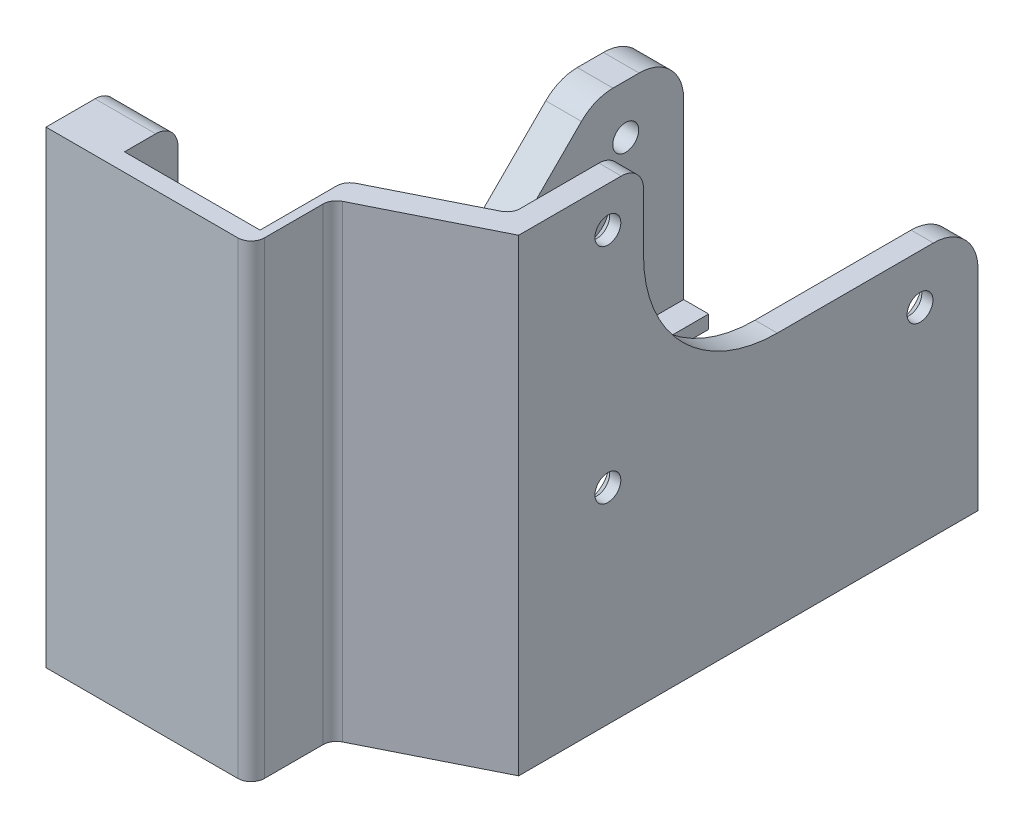
from build123d import *

# Parameters (mm, degrees)
EXTRUDE_1_DEPTH          = 105
SKETCH_7_W               = 30.4
SKETCH_7_H               = 19
EXTRUDE_2_DEPTH          = 3
SKETCH_8_W               = 30.4
SKETCH_8_H               = 12
EXTRUDE_3_DEPTH          = 38
FILLET_1_R               = 5
CUT_EXTRUDE_1_DEPTH      = 112
CUT_EXTRUDE_2_DEPTH      = 97
CUT_EXTRUDE_4_DEPTH      = 187.349134691
CUT_EXTRUDE_4_DEPTH_BACK = 6.8
SKETCH_11_R              = 5
FILLET_3_R               = 3
SKETCH_12_R              = 2.6
CUT_EXTRUDE_5_DEPTH      = 20
CHAMFER_1_SIZE           = 3
SKETCH_13_R              = 2.9
CUT_EXTRUDE_6_DEPTH      = 187.349134691
CHAMFER_3_SIZE           = 2.5
SKETCH_16_W              = 75
SKETCH_16_H              = 48
CUT_EXTRUDE_9_DEPTH      = 187.349134691
FILLET_4_R               = 30
SKETCH_17_W              = 28
SKETCH_17_H              = 52
CUT_EXTRUDE_10_DEPTH     = 20
FILLET_5_R               = 8
SKETCH_18_W              = 8
SKETCH_18_H              = 19
EXTRUDE_4_DEPTH          = 49
CHAMFER_4_SIZE           = 50
FILLET_6_R               = 10
SKETCH_19_R              = 2.9
CUT_EXTRUDE_11_DEPTH     = 187.349134691
CHAMFER_5_SIZE           = 2.6
SKETCH_21_R              = 2.3
CUT_EXTRUDE_13_DEPTH     = 15
FILLET_7_R               = 5
CHAMFER_6_SIZE           = 0.8
SKETCH_22_W              = 8
SKETCH_22_H              = 43.683816014
EXTRUDE_5_DEPTH          = 10
FILLET_8_R               = 10


with BuildPart() as part:
    # Эскиз2 → Бобышка-Вытянуть1 (new body)
    with BuildSketch(Plane(origin=(0, 0, 0), x_dir=(1, 0, 0), z_dir=(0, 1, 0))):
        Polygon((52.378939236, 0), (52.378939236, -103), (24.378939236, -117), (24.378939236, -135), (0, -135), (-21.621060764, -135), (-21.621060764, 0), (-8.021060764, 0), (-8.021060764, -131), (0, -131), (22.378939236, -131), (22.378939236, 0), align=None)
    extrude(amount=EXTRUDE_1_DEPTH)



with BuildPart() as body_2:
    # Эскиз7 → Бобышка-Вытянуть2 (new body)
    with BuildSketch(Plane.XZ):
        with Locations((7.178939236, 121.5)):
            Rectangle(SKETCH_7_W, SKETCH_7_H)
    extrude(amount=-EXTRUDE_2_DEPTH)


with BuildPart() as part_1:
    add(part.part)

    add(body_2.part)  # Бобышка-Вытянуть3 merges body 2
    # Эскиз8 → Бобышка-Вытянуть3 (add)
    with BuildSketch(Plane(origin=(0, 3, 0), x_dir=(1, 0, 0), z_dir=(0, 1, 0))):
        with Locations((7.178939236, -125)):
            Rectangle(SKETCH_8_W, SKETCH_8_H)
    extrude(amount=EXTRUDE_3_DEPTH)

    # Скругление1
    fillet_1_edges = [part_1.edges().sort_by_distance(p)[0] for p in [
        (7.178939236, 41, 119),
    ]]
    fillet(fillet_1_edges, radius=FILLET_1_R)

    # Эскиз3 → Вырез-Вытянуть1 (cut)
    with BuildSketch(Plane(origin=(0, 0, 0), x_dir=(-1, 0, 0), z_dir=(0, 0, -1))):
        Polygon((8.021060764, -1.66), (19.321060764, 3.4), (19.321060764, 5), (8.021060764, 5), align=None)
        Polygon((-33.678939236, 5), (-22.378939236, 5), (-22.378939236, -1.66), (-33.678939236, 3.4), align=None)
    extrude(amount=-CUT_EXTRUDE_1_DEPTH, mode=Mode.SUBTRACT)

    # Эскиз9 → Вырез-Вытянуть2 (cut)
    with BuildSketch(Plane(origin=(0, 105, 0), x_dir=(1, 0, 0), z_dir=(0, 1, 0))):
        Polygon((-21.621060764, 0), (-21.621060764, -91), (22.378939236, -91), (22.378939236, -112), (47.378939236, -99.5), (47.378939236, 0), align=None)
    extrude(amount=-CUT_EXTRUDE_2_DEPTH, mode=Mode.SUBTRACT)

    # Эскиз11 → Вырез-Вытянуть4 (cut, two sides: drawn at the far end of the back side and taken through both)
    with BuildSketch(Plane.ZY.offset(21.621060764).offset(-CUT_EXTRUDE_4_DEPTH_BACK)):
        with Locations(Location((98.6, 41.2, 0), (0, 0, 180))):
            Circle(SKETCH_11_R)
    extrude(amount=CUT_EXTRUDE_4_DEPTH + CUT_EXTRUDE_4_DEPTH_BACK, mode=Mode.SUBTRACT)

    # Скругление3
    fillet_3_edges = [part_1.edges().sort_by_distance(p)[0] for p in [
        (47.378939236, 56.5, 99.5),
        (22.378939236, 56.5, 112),
        (24.378939236, 52.5, 135),
        (24.378939236, 52.5, 117),
    ]]
    fillet(fillet_3_edges, radius=FILLET_3_R)

    # Эскиз12 → Вырез-Вытянуть5 (cut)
    with BuildSketch(Plane.ZY.offset(21.621060764)):
        with Locations((98.6, 41.2)):
            Circle(SKETCH_12_R)
    extrude(amount=-CUT_EXTRUDE_5_DEPTH, mode=Mode.SUBTRACT)

    # Фаска1
    # the kernel refuses this chamfer: 3 mm, written as the material it takes off along each edge
    with BuildSketch(Plane(origin=(-14.821060764, 41.2, 98.6), x_dir=(0, 0, 1), z_dir=(0, -1, 0))) as chamfer_1_piece_1_section:
        Polygon((2.6, -CHAMFER_1_SIZE), (2.6 + CHAMFER_1_SIZE, 0), (2.6, 0), align=None)
    chamfer_1_piece_1 = revolve(axis=Axis((-14.821060764, 41.2, 98.6), (-1, 0, 0)), mode=Mode.PRIVATE)
    chamfer_1_piece_1 = chamfer_1_piece_1 & Plane(origin=(-13.01179882, 41.2, 98.6), x_dir=(0, 0, -1), z_dir=(-1, 0, 0)) * Cylinder(5, 23, mode=Mode.PRIVATE)
    add(chamfer_1_piece_1, mode=Mode.SUBTRACT)

    # Эскиз13 → Вырез-Вытянуть6 (cut, through all)
    with BuildSketch(Plane.ZY.offset(21.621060764)):
        with Locations((83, 46)):
            Circle(SKETCH_13_R)
        with Locations((13, 46)):
            Circle(SKETCH_13_R)
        with Locations((83, 96)):
            Circle(SKETCH_13_R)
    extrude(amount=-CUT_EXTRUDE_6_DEPTH, mode=Mode.SUBTRACT)

    # Фаска3
    chamfer_3_edges = [part_1.edges().sort_by_distance(p)[0] for p in [
        (47.378939236, 96, 80.1),
        (47.378939236, 46, 10.1),
        (47.378939236, 46, 80.1),
    ]]
    chamfer(chamfer_3_edges, length=CHAMFER_3_SIZE)

    # Эскиз16 → Вырез-Вытянуть9 (cut, through all)
    with BuildSketch(Plane.ZY.offset(21.621060764)):
        with Locations((37.5, 81)):
            Rectangle(SKETCH_16_W, SKETCH_16_H)
    extrude(amount=-CUT_EXTRUDE_9_DEPTH, mode=Mode.SUBTRACT)

    # Скругление4
    fillet_4_edges = [part_1.edges().sort_by_distance(p)[0] for p in [
        (49.878939236, 57, 75),
    ]]
    fillet(fillet_4_edges, radius=FILLET_4_R)

    # Эскиз17 → Вырез-Вытянуть10 (cut)
    with BuildSketch(Plane.ZY.offset(21.621060764)):
        with Locations((105, 79)):
            Rectangle(SKETCH_17_W, SKETCH_17_H)
    extrude(amount=-CUT_EXTRUDE_10_DEPTH, mode=Mode.SUBTRACT)

    # Скругление5
    fillet_5_edges = [part_1.edges().sort_by_distance(p)[0] for p in [
        (-14.821060764, 53, 91),
        (-14.821060764, 53, 119),
    ]]
    fillet(fillet_5_edges, radius=FILLET_5_R)

    # Эскиз18 → Бобышка-Вытянуть4 (add)
    with BuildSketch(Plane(origin=(0, 8, 0), x_dir=(1, 0, 0), z_dir=(0, 1, 0))):
        with Locations((-17.621060764, -9.5)):
            Rectangle(SKETCH_18_W, SKETCH_18_H)
    extrude(amount=EXTRUDE_4_DEPTH)

    # Фаска4
    # the kernel refuses this chamfer: 50 mm, written as the material it adds along each edge
    with BuildSketch(Plane(origin=(-13.621060764, 8, 19), x_dir=(0, 0.9996219169112966, -0.027495876610586386), z_dir=(-1, 0, 0))) as chamfer_4_piece_1_section:
        Polygon((CHAMFER_4_SIZE * 0.999621916911, -CHAMFER_4_SIZE * 0.0274958766106), (-CHAMFER_4_SIZE * 0.0274958766106, -CHAMFER_4_SIZE * 0.999621916911), (0, 0), align=None)
    chamfer_4_piece_1 = extrude(amount=8, mode=Mode.PRIVATE)
    chamfer_4_piece_1 = split(chamfer_4_piece_1, bisect_by=Plane(origin=(-17.621060764, 57, 35.555220818), z_dir=(0, -1, 0)), keep=Keep.TOP, mode=Mode.PRIVATE)
    add(chamfer_4_piece_1)

    # Скругление6
    fillet_6_edges = [part_1.edges().sort_by_distance(p)[0] for p in [
        (49.878939236, 57, 0),
        (-17.621060764, 57, 0),
    ]]
    fillet(fillet_6_edges, radius=FILLET_6_R)

    # Эскиз19 → Вырез-Вытянуть11 (cut, through all)
    with BuildSketch(Plane(origin=(52.378939236, 0, 0), x_dir=(0, 0, -1), z_dir=(1, 0, 0))):
        with Locations(Location((-13, 46, 0), (0, 0, 180))):
            Circle(SKETCH_19_R)
    extrude(amount=-CUT_EXTRUDE_11_DEPTH, mode=Mode.SUBTRACT)

    # Фаска5
    chamfer_5_edges = [part_1.edges().sort_by_distance(p)[0] for p in [
        (-21.621060764, 46, 10.1),
    ]]
    chamfer(chamfer_5_edges, length=CHAMFER_5_SIZE)

    # Эскиз21 → Вырез-Вытянуть13 (cut)
    with BuildSketch(Plane.ZY.offset(21.621060764)):
        with Locations((125, 30)):
            Circle(SKETCH_21_R)
        with Locations((125, 90)):
            Circle(SKETCH_21_R)
    extrude(amount=-CUT_EXTRUDE_13_DEPTH, mode=Mode.SUBTRACT)

    # Скругление7
    fillet_7_edges = [part_1.edges().sort_by_distance(p)[0] for p in [
        (49.878939236, 105, 75),
        (-14.821060764, 105, 119),
    ]]
    fillet(fillet_7_edges, radius=FILLET_7_R)

    # Фаска6
    chamfer_6_edges = [part_1.edges().sort_by_distance(p)[0] for p in [
        (-21.621060764, 41.2, 103.6),
        (-21.621060764, 30, 122.7),
        (-21.621060764, 90, 122.7),
    ]]
    chamfer(chamfer_6_edges, length=CHAMFER_6_SIZE)

    # Эскиз22 → Бобышка-Вытянуть5 (add)
    with BuildSketch(Plane(origin=(0, 8, 0), x_dir=(1, 0, 0), z_dir=(0, 1, 0))):
        with Locations((-17.621060764, -69.158091993)):
            Rectangle(SKETCH_22_W, SKETCH_22_H)
    extrude(amount=EXTRUDE_5_DEPTH)

    # Скругление8
    fillet_8_edges = [part_1.edges().sort_by_distance(p)[0] for p in [
        (-17.621060764, 57, 20),
    ]]
    fillet(fillet_8_edges, radius=FILLET_8_R)


solid = part_1.part
